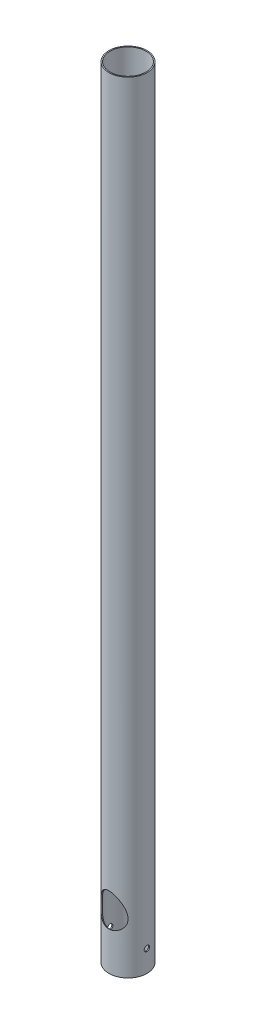
from build123d import *

# Parameters (mm, degrees)
EXTRUDE_1_OUTLINE_R      = 70.5
EXTRUDE_1_OUTLINE_R_2    = 66.5
EXTRUDE_1_DEPTH          = 2880
CUT_EXTRUDE_3_DEPTH      = 2882.72526449
CUT_EXTRUDE_3_DEPTH_BACK = 2882.72526449
SKETCH_6_R               = 10
SKETCH_7_R               = 50
CUT_EXTRUDE_4_DEPTH      = 200
SKETCH_10_R              = 55
CUT_EXTRUDE_5_DEPTH      = 2882.725264595
SKETCH_13_R              = 52.5
CUT_EXTRUDE_8_DEPTH      = 200


# Read off the part's stored shape, not the designer's step: Вытянуть-Тонкостенный1
with BuildPart() as part:
    # Вытянуть-Тонкостенный1 outline → Вытянуть-Тонкостенный1 (new body)
    with BuildSketch(Plane(origin=(0, 0, 0), x_dir=(1, 0, 0), z_dir=(0, 1, 0))):
        Circle(EXTRUDE_1_OUTLINE_R)
        Circle(EXTRUDE_1_OUTLINE_R_2, mode=Mode.SUBTRACT)
    extrude(amount=EXTRUDE_1_DEPTH)

    # Эскиз6 → Вырез-Вытянуть3 (cut, two sides: drawn at the far end of the back side and taken through both)
    with BuildSketch(Plane(origin=(0, 0, 0), x_dir=(0, 0, -1), z_dir=(1, 0, 0)).offset(-CUT_EXTRUDE_3_DEPTH_BACK)):
        with Locations((0, 80)):
            Circle(SKETCH_6_R)
    extrude(amount=CUT_EXTRUDE_3_DEPTH + CUT_EXTRUDE_3_DEPTH_BACK, mode=Mode.SUBTRACT)

    # Эскиз7 → Вырез-Вытянуть4 (cut)
    with BuildSketch(Plane(origin=(0, 176.689515805, 252.338779809), x_dir=(1, 0, 0), z_dir=(0, -0.5735764363510416, -0.8191520442889949))):
        with Locations(Location((0, -126.118813858, 0), (0, 0, 90))):
            Circle(SKETCH_7_R)
    extrude(amount=CUT_EXTRUDE_4_DEPTH, mode=Mode.SUBTRACT)

    # Эскиз10 → Вырез-Вытянуть5 (cut, through all)
    with BuildSketch(Plane.XY):
        with Locations(Location((0, 2730, 0), (0, 0, 90))):
            Circle(SKETCH_10_R)
    extrude(amount=-CUT_EXTRUDE_5_DEPTH, mode=Mode.SUBTRACT)

    # Эскиз13 → Вырез-Вытянуть8 (cut)
    with BuildSketch(Plane(origin=(0, 784.856236496, 1120.890869731), x_dir=(1, 0, 0), z_dir=(0, -0.5735764363510416, -0.8191520442889949))):
        with Locations((0, -2268.034018286)):
            Circle(SKETCH_13_R)
    extrude(amount=-CUT_EXTRUDE_8_DEPTH, mode=Mode.SUBTRACT)


solid = part.part
